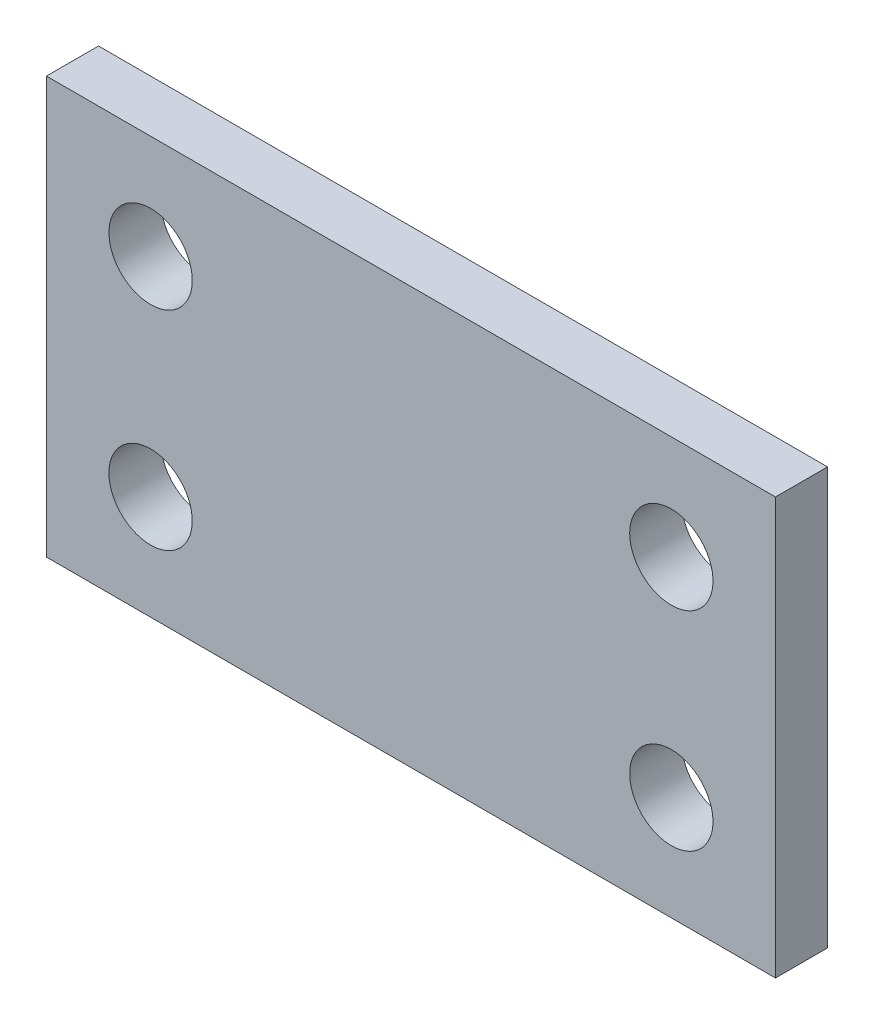
from build123d import *

# Parameters (mm, degrees)
SZKIC1_W                    = 140
SZKIC1_H                    = 80
SZKIC1_R                    = 8
DODANIE_WYCI_GNI_CIE1_DEPTH = 10


with BuildPart() as part:
    # Szkic1 → Dodanie-wyciągnięcie1 (new body)
    with BuildSketch(Plane.XY):
        Rectangle(SZKIC1_W, SZKIC1_H)
        with Locations((-50, 20)):
            Circle(SZKIC1_R, mode=Mode.SUBTRACT)
        with Locations((50, 20)):
            Circle(SZKIC1_R, mode=Mode.SUBTRACT)
        with Locations((50, -20)):
            Circle(SZKIC1_R, mode=Mode.SUBTRACT)
        with Locations((-50, -20)):
            Circle(SZKIC1_R, mode=Mode.SUBTRACT)
    extrude(amount=DODANIE_WYCI_GNI_CIE1_DEPTH)


solid = part.part
